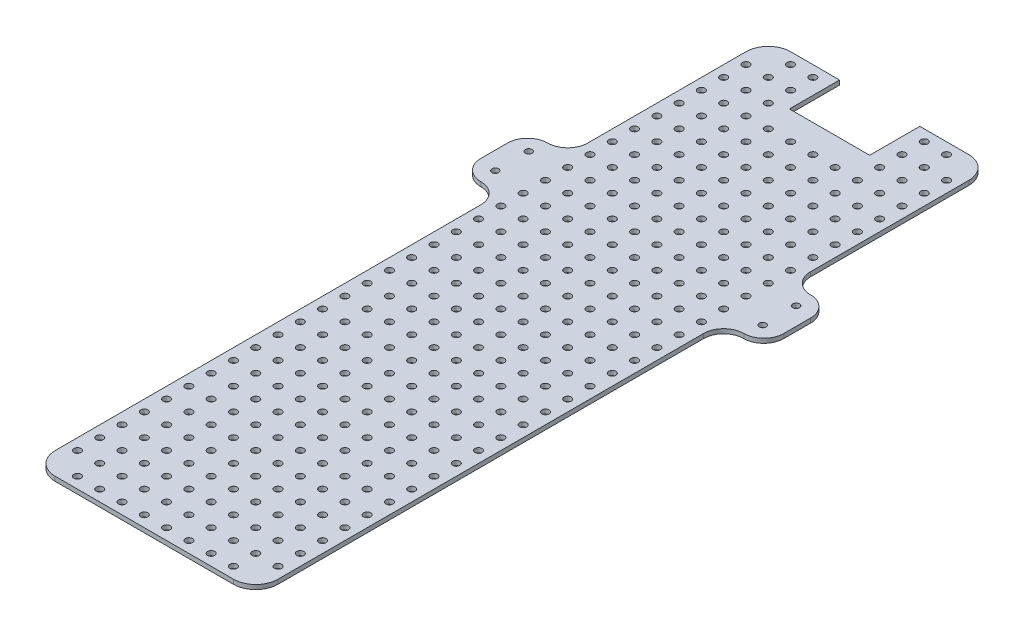
from build123d import *

# Parameters (mm, degrees)
SKETCH_1_W             = 100
SKETCH_1_H             = 330
EXTRUDE_593_DEPTH      = 2
SKETCH_3_W             = 18
SKETCH_3_H             = 30
EXTRUDE_1129_DEPTH     = 2
SKETCH_4_R             = 1.5
CUT_EXTRUDE_1192_DEPTH = 198.111643492
FILLET_4_R             = 10
FILLET_START           = -1
FILLET_6_DEPTH         = 4
FILLET_6_2_DEPTH       = 2
SKETCH_25_W            = 36
SKETCH_25_H            = 22.5
CUT_EXTRUDE_6939_DEPTH = 198.111643492
FILLET_8_R             = 10
SKETCH_31_R            = 1.6
CUT_EXTRUDE_10_DEPTH   = 2


with BuildPart() as part:
    # Эскиз1 → Extrude 593 (new body)
    with BuildSketch(Plane(origin=(0, 0, 0), x_dir=(1, 0, 0), z_dir=(0, 1, 0))):
        with Locations((0, -20)):
            Rectangle(SKETCH_1_W, SKETCH_1_H)
    extrude(amount=EXTRUDE_593_DEPTH)

    # Эскиз3 → Extrude 1129 (add)
    with BuildSketch(Plane(origin=(0, 2, 0), x_dir=(1, 0, 0), z_dir=(0, 1, 0))):
        with Locations((-59, 40)):
            Rectangle(SKETCH_3_W, SKETCH_3_H)
        with Locations((59, 40)):
            Rectangle(SKETCH_3_W, SKETCH_3_H)
    extrude(amount=-EXTRUDE_1129_DEPTH)

    # Эскиз4 → Cut-Extrude 1192 (cut, through all)
    with BuildSketch(Plane(origin=(0, 2, 0), x_dir=(1, 0, 0), z_dir=(0, 1, 0))):
        with Locations(Location((-60, 47.5, 0), (0, 0, 270))):
            Circle(SKETCH_4_R)
        with Locations(Location((-60, 32.5, 0), (0, 0, 270))):
            Circle(SKETCH_4_R)
        with Locations(Location((60, 47.5, 0), (0, 0, 270))):
            Circle(SKETCH_4_R)
        with Locations(Location((60, 32.5, 0), (0, 0, 270))):
            Circle(SKETCH_4_R)
    extrude(amount=-CUT_EXTRUDE_1192_DEPTH, mode=Mode.SUBTRACT)

    # Скругление4
    fillet_4_edges = [part.edges().sort_by_distance(p)[0] for p in [
        (50, 1, 185),
        (-50, 1, 185),
    ]]
    fillet(fillet_4_edges, radius=FILLET_4_R)

    # Скругление6: read off the stored shape, not the designer's step
    # Скругление6 outline → Скругление6 (cut)
    with BuildSketch(Plane(origin=(0, 0, 0), x_dir=(1, 0, 0), z_dir=(0, 1, 0)).offset(FILLET_START)):
        with BuildLine():
            Line((-68, 55), (-68, 46))
            ThreePointArc((-68, 46), (-65.363961031, 52.363961031), (-59, 55))
            Line((-59, 55), (-68, 55))
        make_face()
        with BuildLine():
            ThreePointArc((-59, 25), (-65.363961031, 27.636038969), (-68, 34))
            Line((-68, 34), (-68, 25))
            Line((-68, 25), (-59, 25))
        make_face()
        with BuildLine():
            ThreePointArc((59, 55), (65.363961031, 52.363961031), (68, 46))
            Line((68, 46), (68, 55))
            Line((68, 55), (59, 55))
        make_face()
        with BuildLine():
            ThreePointArc((68, 34), (65.363961031, 27.636038969), (59, 25))
            Line((59, 25), (68, 25))
            Line((68, 25), (68, 34))
        make_face()
    extrude(amount=FILLET_6_DEPTH, mode=Mode.SUBTRACT)

    # Fillet 6 2 outline → Fillet 6 2 (add)
    with BuildSketch(Plane(origin=(0, 0, 0), x_dir=(1, 0, 0), z_dir=(0, 1, 0))):
        with BuildLine():
            Line((-50, 25), (-59, 25))
            ThreePointArc((-59, 25), (-52.636038969, 22.363961031), (-50, 16))
            Line((-50, 16), (-50, 25))
        make_face()
        with BuildLine():
            ThreePointArc((-50, 64), (-52.636038969, 57.636038969), (-59, 55))
            Line((-59, 55), (-50, 55))
            Line((-50, 55), (-50, 64))
        make_face()
        with BuildLine():
            Line((50, 55), (59, 55))
            ThreePointArc((59, 55), (52.636038969, 57.636038969), (50, 64))
            Line((50, 64), (50, 55))
        make_face()
        with BuildLine():
            ThreePointArc((50, 16), (52.636038969, 22.363961031), (59, 25))
            Line((59, 25), (50, 25))
            Line((50, 25), (50, 16))
        make_face()
    extrude(amount=FILLET_6_2_DEPTH)

    # Эскиз25 → Cut-Extrude 6939 (cut, through all)
    with BuildSketch(Plane(origin=(0, 2, 0), x_dir=(1, 0, 0), z_dir=(0, 1, 0))):
        with Locations((0, 133.75)):
            Rectangle(SKETCH_25_W, SKETCH_25_H)
    extrude(amount=-CUT_EXTRUDE_6939_DEPTH, mode=Mode.SUBTRACT)

    # Скругление8
    fillet_8_edges = [part.edges().sort_by_distance(p)[0] for p in [
        (-50, 1, -145),
        (50, 1, -145),
    ]]
    fillet(fillet_8_edges, radius=FILLET_8_R)

    # Эскиз31 → Сетка 10мм (cut)
    with BuildSketch(Plane.XZ):
        with Locations(Location((-5, 180, 0), (0, 0, 270))):
            Circle(SKETCH_31_R)
        with Locations(Location((5, 180, 0), (0, 0, 270))):
            Circle(SKETCH_31_R)
        with Locations(Location((15, 180, 0), (0, 0, 270))):
            Circle(SKETCH_31_R)
        with Locations(Location((25, 180, 0), (0, 0, 270))):
            Circle(SKETCH_31_R)
        with Locations(Location((35, 180, 0), (0, 0, 270))):
            Circle(SKETCH_31_R)
        with Locations(Location((-15, 180, 0), (0, 0, 270))):
            Circle(SKETCH_31_R)
        with Locations(Location((-25, 180, 0), (0, 0, 270))):
            Circle(SKETCH_31_R)
        with Locations(Location((-35, 180, 0), (0, 0, 270))):
            Circle(SKETCH_31_R)
        with Locations(Location((-5, 170, 0), (0, 0, 270))):
            Circle(SKETCH_31_R)
        with Locations(Location((5, 170, 0), (0, 0, 270))):
            Circle(SKETCH_31_R)
        with Locations(Location((15, 170, 0), (0, 0, 270))):
            Circle(SKETCH_31_R)
        with Locations(Location((25, 170, 0), (0, 0, 270))):
            Circle(SKETCH_31_R)
        with Locations(Location((35, 170, 0), (0, 0, 270))):
            Circle(SKETCH_31_R)
        with Locations(Location((45, 170, 0), (0, 0, 270))):
            Circle(SKETCH_31_R)
        with Locations(Location((-15, 170, 0), (0, 0, 270))):
            Circle(SKETCH_31_R)
        with Locations(Location((-25, 170, 0), (0, 0, 270))):
            Circle(SKETCH_31_R)
        with Locations(Location((-35, 170, 0), (0, 0, 270))):
            Circle(SKETCH_31_R)
        with Locations(Location((-45, 170, 0), (0, 0, 270))):
            Circle(SKETCH_31_R)
        with Locations(Location((-5, 160, 0), (0, 0, 270))):
            Circle(SKETCH_31_R)
        with Locations(Location((5, 160, 0), (0, 0, 270))):
            Circle(SKETCH_31_R)
        with Locations(Location((15, 160, 0), (0, 0, 270))):
            Circle(SKETCH_31_R)
        with Locations(Location((25, 160, 0), (0, 0, 270))):
            Circle(SKETCH_31_R)
        with Locations(Location((35, 160, 0), (0, 0, 270))):
            Circle(SKETCH_31_R)
        with Locations(Location((45, 160, 0), (0, 0, 270))):
            Circle(SKETCH_31_R)
        with Locations(Location((-15, 160, 0), (0, 0, 270))):
            Circle(SKETCH_31_R)
        with Locations(Location((-25, 160, 0), (0, 0, 270))):
            Circle(SKETCH_31_R)
        with Locations(Location((-35, 160, 0), (0, 0, 270))):
            Circle(SKETCH_31_R)
        with Locations(Location((-45, 160, 0), (0, 0, 270))):
            Circle(SKETCH_31_R)
        with Locations(Location((-5, 150, 0), (0, 0, 270))):
            Circle(SKETCH_31_R)
        with Locations(Location((5, 150, 0), (0, 0, 270))):
            Circle(SKETCH_31_R)
        with Locations(Location((15, 150, 0), (0, 0, 270))):
            Circle(SKETCH_31_R)
        with Locations(Location((25, 150, 0), (0, 0, 270))):
            Circle(SKETCH_31_R)
        with Locations(Location((35, 150, 0), (0, 0, 270))):
            Circle(SKETCH_31_R)
        with Locations(Location((45, 150, 0), (0, 0, 270))):
            Circle(SKETCH_31_R)
        with Locations(Location((-15, 150, 0), (0, 0, 270))):
            Circle(SKETCH_31_R)
        with Locations(Location((-25, 150, 0), (0, 0, 270))):
            Circle(SKETCH_31_R)
        with Locations(Location((-35, 150, 0), (0, 0, 270))):
            Circle(SKETCH_31_R)
        with Locations(Location((-45, 150, 0), (0, 0, 270))):
            Circle(SKETCH_31_R)
        with Locations(Location((-5, 140, 0), (0, 0, 270))):
            Circle(SKETCH_31_R)
        with Locations(Location((5, 140, 0), (0, 0, 270))):
            Circle(SKETCH_31_R)
        with Locations(Location((15, 140, 0), (0, 0, 270))):
            Circle(SKETCH_31_R)
        with Locations(Location((25, 140, 0), (0, 0, 270))):
            Circle(SKETCH_31_R)
        with Locations(Location((35, 140, 0), (0, 0, 270))):
            Circle(SKETCH_31_R)
        with Locations(Location((45, 140, 0), (0, 0, 270))):
            Circle(SKETCH_31_R)
        with Locations(Location((-15, 140, 0), (0, 0, 270))):
            Circle(SKETCH_31_R)
        with Locations(Location((-25, 140, 0), (0, 0, 270))):
            Circle(SKETCH_31_R)
        with Locations(Location((-35, 140, 0), (0, 0, 270))):
            Circle(SKETCH_31_R)
        with Locations(Location((-45, 140, 0), (0, 0, 270))):
            Circle(SKETCH_31_R)
        with Locations(Location((-5, 130, 0), (0, 0, 270))):
            Circle(SKETCH_31_R)
        with Locations(Location((5, 130, 0), (0, 0, 270))):
            Circle(SKETCH_31_R)
        with Locations(Location((15, 130, 0), (0, 0, 270))):
            Circle(SKETCH_31_R)
        with Locations(Location((25, 130, 0), (0, 0, 270))):
            Circle(SKETCH_31_R)
        with Locations(Location((35, 130, 0), (0, 0, 270))):
            Circle(SKETCH_31_R)
        with Locations(Location((45, 130, 0), (0, 0, 270))):
            Circle(SKETCH_31_R)
        with Locations(Location((-15, 130, 0), (0, 0, 270))):
            Circle(SKETCH_31_R)
        with Locations(Location((-25, 130, 0), (0, 0, 270))):
            Circle(SKETCH_31_R)
        with Locations(Location((-35, 130, 0), (0, 0, 270))):
            Circle(SKETCH_31_R)
        with Locations(Location((-45, 130, 0), (0, 0, 270))):
            Circle(SKETCH_31_R)
        with Locations(Location((-5, 120, 0), (0, 0, 270))):
            Circle(SKETCH_31_R)
        with Locations(Location((5, 120, 0), (0, 0, 270))):
            Circle(SKETCH_31_R)
        with Locations(Location((15, 120, 0), (0, 0, 270))):
            Circle(SKETCH_31_R)
        with Locations(Location((25, 120, 0), (0, 0, 270))):
            Circle(SKETCH_31_R)
        with Locations(Location((35, 120, 0), (0, 0, 270))):
            Circle(SKETCH_31_R)
        with Locations(Location((45, 120, 0), (0, 0, 270))):
            Circle(SKETCH_31_R)
        with Locations(Location((-15, 120, 0), (0, 0, 270))):
            Circle(SKETCH_31_R)
        with Locations(Location((-25, 120, 0), (0, 0, 270))):
            Circle(SKETCH_31_R)
        with Locations(Location((-35, 120, 0), (0, 0, 270))):
            Circle(SKETCH_31_R)
        with Locations(Location((-45, 120, 0), (0, 0, 270))):
            Circle(SKETCH_31_R)
        with Locations(Location((-5, 110, 0), (0, 0, 270))):
            Circle(SKETCH_31_R)
        with Locations(Location((5, 110, 0), (0, 0, 270))):
            Circle(SKETCH_31_R)
        with Locations(Location((15, 110, 0), (0, 0, 270))):
            Circle(SKETCH_31_R)
        with Locations(Location((25, 110, 0), (0, 0, 270))):
            Circle(SKETCH_31_R)
        with Locations(Location((35, 110, 0), (0, 0, 270))):
            Circle(SKETCH_31_R)
        with Locations(Location((45, 110, 0), (0, 0, 270))):
            Circle(SKETCH_31_R)
        with Locations(Location((-15, 110, 0), (0, 0, 270))):
            Circle(SKETCH_31_R)
        with Locations(Location((-25, 110, 0), (0, 0, 270))):
            Circle(SKETCH_31_R)
        with Locations(Location((-35, 110, 0), (0, 0, 270))):
            Circle(SKETCH_31_R)
        with Locations(Location((-45, 110, 0), (0, 0, 270))):
            Circle(SKETCH_31_R)
        with Locations(Location((-5, 100, 0), (0, 0, 270))):
            Circle(SKETCH_31_R)
        with Locations(Location((5, 100, 0), (0, 0, 270))):
            Circle(SKETCH_31_R)
        with Locations(Location((15, 100, 0), (0, 0, 270))):
            Circle(SKETCH_31_R)
        with Locations(Location((25, 100, 0), (0, 0, 270))):
            Circle(SKETCH_31_R)
        with Locations(Location((35, 100, 0), (0, 0, 270))):
            Circle(SKETCH_31_R)
        with Locations(Location((45, 100, 0), (0, 0, 270))):
            Circle(SKETCH_31_R)
        with Locations(Location((-15, 100, 0), (0, 0, 270))):
            Circle(SKETCH_31_R)
        with Locations(Location((-25, 100, 0), (0, 0, 270))):
            Circle(SKETCH_31_R)
        with Locations(Location((-35, 100, 0), (0, 0, 270))):
            Circle(SKETCH_31_R)
        with Locations(Location((-45, 100, 0), (0, 0, 270))):
            Circle(SKETCH_31_R)
        with Locations(Location((-5, 90, 0), (0, 0, 270))):
            Circle(SKETCH_31_R)
        with Locations(Location((5, 90, 0), (0, 0, 270))):
            Circle(SKETCH_31_R)
        with Locations(Location((15, 90, 0), (0, 0, 270))):
            Circle(SKETCH_31_R)
        with Locations(Location((25, 90, 0), (0, 0, 270))):
            Circle(SKETCH_31_R)
        with Locations(Location((35, 90, 0), (0, 0, 270))):
            Circle(SKETCH_31_R)
        with Locations(Location((45, 90, 0), (0, 0, 270))):
            Circle(SKETCH_31_R)
        with Locations(Location((-15, 90, 0), (0, 0, 270))):
            Circle(SKETCH_31_R)
        with Locations(Location((-25, 90, 0), (0, 0, 270))):
            Circle(SKETCH_31_R)
        with Locations(Location((-35, 90, 0), (0, 0, 270))):
            Circle(SKETCH_31_R)
        with Locations(Location((-45, 90, 0), (0, 0, 270))):
            Circle(SKETCH_31_R)
        with Locations(Location((-5, 80, 0), (0, 0, 270))):
            Circle(SKETCH_31_R)
        with Locations(Location((5, 80, 0), (0, 0, 270))):
            Circle(SKETCH_31_R)
        with Locations(Location((15, 80, 0), (0, 0, 270))):
            Circle(SKETCH_31_R)
        with Locations(Location((25, 80, 0), (0, 0, 270))):
            Circle(SKETCH_31_R)
        with Locations(Location((35, 80, 0), (0, 0, 270))):
            Circle(SKETCH_31_R)
        with Locations(Location((45, 80, 0), (0, 0, 270))):
            Circle(SKETCH_31_R)
        with Locations(Location((-15, 80, 0), (0, 0, 270))):
            Circle(SKETCH_31_R)
        with Locations(Location((-25, 80, 0), (0, 0, 270))):
            Circle(SKETCH_31_R)
        with Locations(Location((-35, 80, 0), (0, 0, 270))):
            Circle(SKETCH_31_R)
        with Locations(Location((-45, 80, 0), (0, 0, 270))):
            Circle(SKETCH_31_R)
        with Locations(Location((-5, 70, 0), (0, 0, 270))):
            Circle(SKETCH_31_R)
        with Locations(Location((5, 70, 0), (0, 0, 270))):
            Circle(SKETCH_31_R)
        with Locations(Location((15, 70, 0), (0, 0, 270))):
            Circle(SKETCH_31_R)
        with Locations(Location((25, 70, 0), (0, 0, 270))):
            Circle(SKETCH_31_R)
        with Locations(Location((35, 70, 0), (0, 0, 270))):
            Circle(SKETCH_31_R)
        with Locations(Location((45, 70, 0), (0, 0, 270))):
            Circle(SKETCH_31_R)
        with Locations(Location((-15, 70, 0), (0, 0, 270))):
            Circle(SKETCH_31_R)
        with Locations(Location((-25, 70, 0), (0, 0, 270))):
            Circle(SKETCH_31_R)
        with Locations(Location((-35, 70, 0), (0, 0, 270))):
            Circle(SKETCH_31_R)
        with Locations(Location((-45, 70, 0), (0, 0, 270))):
            Circle(SKETCH_31_R)
        with Locations(Location((-5, 60, 0), (0, 0, 270))):
            Circle(SKETCH_31_R)
        with Locations(Location((5, 60, 0), (0, 0, 270))):
            Circle(SKETCH_31_R)
        with Locations(Location((15, 60, 0), (0, 0, 270))):
            Circle(SKETCH_31_R)
        with Locations(Location((25, 60, 0), (0, 0, 270))):
            Circle(SKETCH_31_R)
        with Locations(Location((35, 60, 0), (0, 0, 270))):
            Circle(SKETCH_31_R)
        with Locations(Location((45, 60, 0), (0, 0, 270))):
            Circle(SKETCH_31_R)
        with Locations(Location((-15, 60, 0), (0, 0, 270))):
            Circle(SKETCH_31_R)
        with Locations(Location((-25, 60, 0), (0, 0, 270))):
            Circle(SKETCH_31_R)
        with Locations(Location((-35, 60, 0), (0, 0, 270))):
            Circle(SKETCH_31_R)
        with Locations(Location((-45, 60, 0), (0, 0, 270))):
            Circle(SKETCH_31_R)
        with Locations(Location((-5, 50, 0), (0, 0, 270))):
            Circle(SKETCH_31_R)
        with Locations(Location((5, 50, 0), (0, 0, 270))):
            Circle(SKETCH_31_R)
        with Locations(Location((15, 50, 0), (0, 0, 270))):
            Circle(SKETCH_31_R)
        with Locations(Location((25, 50, 0), (0, 0, 270))):
            Circle(SKETCH_31_R)
        with Locations(Location((35, 50, 0), (0, 0, 270))):
            Circle(SKETCH_31_R)
        with Locations(Location((45, 50, 0), (0, 0, 270))):
            Circle(SKETCH_31_R)
        with Locations(Location((-15, 50, 0), (0, 0, 270))):
            Circle(SKETCH_31_R)
        with Locations(Location((-25, 50, 0), (0, 0, 270))):
            Circle(SKETCH_31_R)
        with Locations(Location((-35, 50, 0), (0, 0, 270))):
            Circle(SKETCH_31_R)
        with Locations(Location((-45, 50, 0), (0, 0, 270))):
            Circle(SKETCH_31_R)
        with Locations(Location((-5, 40, 0), (0, 0, 270))):
            Circle(SKETCH_31_R)
        with Locations(Location((5, 40, 0), (0, 0, 270))):
            Circle(SKETCH_31_R)
        with Locations(Location((15, 40, 0), (0, 0, 270))):
            Circle(SKETCH_31_R)
        with Locations(Location((25, 40, 0), (0, 0, 270))):
            Circle(SKETCH_31_R)
        with Locations(Location((35, 40, 0), (0, 0, 270))):
            Circle(SKETCH_31_R)
        with Locations(Location((45, 40, 0), (0, 0, 270))):
            Circle(SKETCH_31_R)
        with Locations(Location((-15, 40, 0), (0, 0, 270))):
            Circle(SKETCH_31_R)
        with Locations(Location((-25, 40, 0), (0, 0, 270))):
            Circle(SKETCH_31_R)
        with Locations(Location((-35, 40, 0), (0, 0, 270))):
            Circle(SKETCH_31_R)
        with Locations(Location((-45, 40, 0), (0, 0, 270))):
            Circle(SKETCH_31_R)
        with Locations(Location((-5, 30, 0), (0, 0, 270))):
            Circle(SKETCH_31_R)
        with Locations(Location((5, 30, 0), (0, 0, 270))):
            Circle(SKETCH_31_R)
        with Locations(Location((15, 30, 0), (0, 0, 270))):
            Circle(SKETCH_31_R)
        with Locations(Location((25, 30, 0), (0, 0, 270))):
            Circle(SKETCH_31_R)
        with Locations(Location((35, 30, 0), (0, 0, 270))):
            Circle(SKETCH_31_R)
        with Locations(Location((45, 30, 0), (0, 0, 270))):
            Circle(SKETCH_31_R)
        with Locations(Location((-15, 30, 0), (0, 0, 270))):
            Circle(SKETCH_31_R)
        with Locations(Location((-25, 30, 0), (0, 0, 270))):
            Circle(SKETCH_31_R)
        with Locations(Location((-35, 30, 0), (0, 0, 270))):
            Circle(SKETCH_31_R)
        with Locations(Location((-45, 30, 0), (0, 0, 270))):
            Circle(SKETCH_31_R)
        with Locations(Location((-5, 20, 0), (0, 0, 270))):
            Circle(SKETCH_31_R)
        with Locations(Location((5, 20, 0), (0, 0, 270))):
            Circle(SKETCH_31_R)
        with Locations(Location((15, 20, 0), (0, 0, 270))):
            Circle(SKETCH_31_R)
        with Locations(Location((25, 20, 0), (0, 0, 270))):
            Circle(SKETCH_31_R)
        with Locations(Location((35, 20, 0), (0, 0, 270))):
            Circle(SKETCH_31_R)
        with Locations(Location((45, 20, 0), (0, 0, 270))):
            Circle(SKETCH_31_R)
        with Locations(Location((-15, 20, 0), (0, 0, 270))):
            Circle(SKETCH_31_R)
        with Locations(Location((-25, 20, 0), (0, 0, 270))):
            Circle(SKETCH_31_R)
        with Locations(Location((-35, 20, 0), (0, 0, 270))):
            Circle(SKETCH_31_R)
        with Locations(Location((-45, 20, 0), (0, 0, 270))):
            Circle(SKETCH_31_R)
        with Locations(Location((-5, 10, 0), (0, 0, 270))):
            Circle(SKETCH_31_R)
        with Locations(Location((5, 10, 0), (0, 0, 270))):
            Circle(SKETCH_31_R)
        with Locations(Location((15, 10, 0), (0, 0, 270))):
            Circle(SKETCH_31_R)
        with Locations(Location((25, 10, 0), (0, 0, 270))):
            Circle(SKETCH_31_R)
        with Locations(Location((35, 10, 0), (0, 0, 270))):
            Circle(SKETCH_31_R)
        with Locations(Location((45, 10, 0), (0, 0, 270))):
            Circle(SKETCH_31_R)
        with Locations(Location((-15, 10, 0), (0, 0, 270))):
            Circle(SKETCH_31_R)
        with Locations(Location((-25, 10, 0), (0, 0, 270))):
            Circle(SKETCH_31_R)
        with Locations(Location((-35, 10, 0), (0, 0, 270))):
            Circle(SKETCH_31_R)
        with Locations(Location((-45, 10, 0), (0, 0, 270))):
            Circle(SKETCH_31_R)
        with Locations(Location((-5, 0, 0), (0, 0, 270))):
            Circle(SKETCH_31_R)
        with Locations(Location((5, 0, 0), (0, 0, 270))):
            Circle(SKETCH_31_R)
        with Locations(Location((15, 0, 0), (0, 0, 270))):
            Circle(SKETCH_31_R)
        with Locations(Location((25, 0, 0), (0, 0, 270))):
            Circle(SKETCH_31_R)
        with Locations(Location((35, 0, 0), (0, 0, 270))):
            Circle(SKETCH_31_R)
        with Locations(Location((45, 0, 0), (0, 0, 270))):
            Circle(SKETCH_31_R)
        with Locations(Location((-15, 0, 0), (0, 0, 270))):
            Circle(SKETCH_31_R)
        with Locations(Location((-25, 0, 0), (0, 0, 270))):
            Circle(SKETCH_31_R)
        with Locations(Location((-35, 0, 0), (0, 0, 270))):
            Circle(SKETCH_31_R)
        with Locations(Location((-45, 0, 0), (0, 0, 270))):
            Circle(SKETCH_31_R)
        with Locations(Location((-5, -10, 0), (0, 0, 270))):
            Circle(SKETCH_31_R)
        with Locations(Location((5, -10, 0), (0, 0, 270))):
            Circle(SKETCH_31_R)
        with Locations(Location((15, -10, 0), (0, 0, 270))):
            Circle(SKETCH_31_R)
        with Locations(Location((25, -10, 0), (0, 0, 270))):
            Circle(SKETCH_31_R)
        with Locations(Location((35, -10, 0), (0, 0, 270))):
            Circle(SKETCH_31_R)
        with Locations(Location((45, -10, 0), (0, 0, 270))):
            Circle(SKETCH_31_R)
        with Locations(Location((-15, -10, 0), (0, 0, 270))):
            Circle(SKETCH_31_R)
        with Locations(Location((-25, -10, 0), (0, 0, 270))):
            Circle(SKETCH_31_R)
        with Locations(Location((-35, -10, 0), (0, 0, 270))):
            Circle(SKETCH_31_R)
        with Locations(Location((-45, -10, 0), (0, 0, 270))):
            Circle(SKETCH_31_R)
        with Locations(Location((-5, -20, 0), (0, 0, 270))):
            Circle(SKETCH_31_R)
        with Locations(Location((5, -20, 0), (0, 0, 270))):
            Circle(SKETCH_31_R)
        with Locations(Location((15, -20, 0), (0, 0, 270))):
            Circle(SKETCH_31_R)
        with Locations(Location((25, -20, 0), (0, 0, 270))):
            Circle(SKETCH_31_R)
        with Locations(Location((35, -20, 0), (0, 0, 270))):
            Circle(SKETCH_31_R)
        with Locations(Location((45, -20, 0), (0, 0, 270))):
            Circle(SKETCH_31_R)
        with Locations(Location((-15, -20, 0), (0, 0, 270))):
            Circle(SKETCH_31_R)
        with Locations(Location((-25, -20, 0), (0, 0, 270))):
            Circle(SKETCH_31_R)
        with Locations(Location((-35, -20, 0), (0, 0, 270))):
            Circle(SKETCH_31_R)
        with Locations(Location((-45, -20, 0), (0, 0, 270))):
            Circle(SKETCH_31_R)
        with Locations(Location((-5, -30, 0), (0, 0, 270))):
            Circle(SKETCH_31_R)
        with Locations(Location((5, -30, 0), (0, 0, 270))):
            Circle(SKETCH_31_R)
        with Locations(Location((15, -30, 0), (0, 0, 270))):
            Circle(SKETCH_31_R)
        with Locations(Location((25, -30, 0), (0, 0, 270))):
            Circle(SKETCH_31_R)
        with Locations(Location((35, -30, 0), (0, 0, 270))):
            Circle(SKETCH_31_R)
        with Locations(Location((45, -30, 0), (0, 0, 270))):
            Circle(SKETCH_31_R)
        with Locations(Location((-15, -30, 0), (0, 0, 270))):
            Circle(SKETCH_31_R)
        with Locations(Location((-25, -30, 0), (0, 0, 270))):
            Circle(SKETCH_31_R)
        with Locations(Location((-35, -30, 0), (0, 0, 270))):
            Circle(SKETCH_31_R)
        with Locations(Location((-45, -30, 0), (0, 0, 270))):
            Circle(SKETCH_31_R)
        with Locations(Location((-5, -40, 0), (0, 0, 270))):
            Circle(SKETCH_31_R)
        with Locations(Location((5, -40, 0), (0, 0, 270))):
            Circle(SKETCH_31_R)
        with Locations(Location((15, -40, 0), (0, 0, 270))):
            Circle(SKETCH_31_R)
        with Locations(Location((25, -40, 0), (0, 0, 270))):
            Circle(SKETCH_31_R)
        with Locations(Location((35, -40, 0), (0, 0, 270))):
            Circle(SKETCH_31_R)
        with Locations(Location((45, -40, 0), (0, 0, 270))):
            Circle(SKETCH_31_R)
        with Locations(Location((-15, -40, 0), (0, 0, 270))):
            Circle(SKETCH_31_R)
        with Locations(Location((-25, -40, 0), (0, 0, 270))):
            Circle(SKETCH_31_R)
        with Locations(Location((-35, -40, 0), (0, 0, 270))):
            Circle(SKETCH_31_R)
        with Locations(Location((-45, -40, 0), (0, 0, 270))):
            Circle(SKETCH_31_R)
        with Locations(Location((-5, -50, 0), (0, 0, 270))):
            Circle(SKETCH_31_R)
        with Locations(Location((5, -50, 0), (0, 0, 270))):
            Circle(SKETCH_31_R)
        with Locations(Location((15, -50, 0), (0, 0, 270))):
            Circle(SKETCH_31_R)
        with Locations(Location((25, -50, 0), (0, 0, 270))):
            Circle(SKETCH_31_R)
        with Locations(Location((35, -50, 0), (0, 0, 270))):
            Circle(SKETCH_31_R)
        with Locations(Location((45, -50, 0), (0, 0, 270))):
            Circle(SKETCH_31_R)
        with Locations(Location((-15, -50, 0), (0, 0, 270))):
            Circle(SKETCH_31_R)
        with Locations(Location((-25, -50, 0), (0, 0, 270))):
            Circle(SKETCH_31_R)
        with Locations(Location((-35, -50, 0), (0, 0, 270))):
            Circle(SKETCH_31_R)
        with Locations(Location((-45, -50, 0), (0, 0, 270))):
            Circle(SKETCH_31_R)
        with Locations(Location((-5, -60, 0), (0, 0, 270))):
            Circle(SKETCH_31_R)
        with Locations(Location((5, -60, 0), (0, 0, 270))):
            Circle(SKETCH_31_R)
        with Locations(Location((15, -60, 0), (0, 0, 270))):
            Circle(SKETCH_31_R)
        with Locations(Location((25, -60, 0), (0, 0, 270))):
            Circle(SKETCH_31_R)
        with Locations(Location((35, -60, 0), (0, 0, 270))):
            Circle(SKETCH_31_R)
        with Locations(Location((45, -60, 0), (0, 0, 270))):
            Circle(SKETCH_31_R)
        with Locations(Location((-15, -60, 0), (0, 0, 270))):
            Circle(SKETCH_31_R)
        with Locations(Location((-25, -60, 0), (0, 0, 270))):
            Circle(SKETCH_31_R)
        with Locations(Location((-35, -60, 0), (0, 0, 270))):
            Circle(SKETCH_31_R)
        with Locations(Location((-45, -60, 0), (0, 0, 270))):
            Circle(SKETCH_31_R)
        with Locations(Location((-5, -70, 0), (0, 0, 270))):
            Circle(SKETCH_31_R)
        with Locations(Location((5, -70, 0), (0, 0, 270))):
            Circle(SKETCH_31_R)
        with Locations(Location((15, -70, 0), (0, 0, 270))):
            Circle(SKETCH_31_R)
        with Locations(Location((25, -70, 0), (0, 0, 270))):
            Circle(SKETCH_31_R)
        with Locations(Location((35, -70, 0), (0, 0, 270))):
            Circle(SKETCH_31_R)
        with Locations(Location((45, -70, 0), (0, 0, 270))):
            Circle(SKETCH_31_R)
        with Locations(Location((-15, -70, 0), (0, 0, 270))):
            Circle(SKETCH_31_R)
        with Locations(Location((-25, -70, 0), (0, 0, 270))):
            Circle(SKETCH_31_R)
        with Locations(Location((-35, -70, 0), (0, 0, 270))):
            Circle(SKETCH_31_R)
        with Locations(Location((-45, -70, 0), (0, 0, 270))):
            Circle(SKETCH_31_R)
        with Locations(Location((-5, -80, 0), (0, 0, 270))):
            Circle(SKETCH_31_R)
        with Locations(Location((5, -80, 0), (0, 0, 270))):
            Circle(SKETCH_31_R)
        with Locations(Location((15, -80, 0), (0, 0, 270))):
            Circle(SKETCH_31_R)
        with Locations(Location((25, -80, 0), (0, 0, 270))):
            Circle(SKETCH_31_R)
        with Locations(Location((35, -80, 0), (0, 0, 270))):
            Circle(SKETCH_31_R)
        with Locations(Location((45, -80, 0), (0, 0, 270))):
            Circle(SKETCH_31_R)
        with Locations(Location((-15, -80, 0), (0, 0, 270))):
            Circle(SKETCH_31_R)
        with Locations(Location((-25, -80, 0), (0, 0, 270))):
            Circle(SKETCH_31_R)
        with Locations(Location((-35, -80, 0), (0, 0, 270))):
            Circle(SKETCH_31_R)
        with Locations(Location((-45, -80, 0), (0, 0, 270))):
            Circle(SKETCH_31_R)
        with Locations(Location((-5, -90, 0), (0, 0, 270))):
            Circle(SKETCH_31_R)
        with Locations(Location((5, -90, 0), (0, 0, 270))):
            Circle(SKETCH_31_R)
        with Locations(Location((15, -90, 0), (0, 0, 270))):
            Circle(SKETCH_31_R)
        with Locations(Location((25, -90, 0), (0, 0, 270))):
            Circle(SKETCH_31_R)
        with Locations(Location((35, -90, 0), (0, 0, 270))):
            Circle(SKETCH_31_R)
        with Locations(Location((45, -90, 0), (0, 0, 270))):
            Circle(SKETCH_31_R)
        with Locations(Location((-15, -90, 0), (0, 0, 270))):
            Circle(SKETCH_31_R)
        with Locations(Location((-25, -90, 0), (0, 0, 270))):
            Circle(SKETCH_31_R)
        with Locations(Location((-35, -90, 0), (0, 0, 270))):
            Circle(SKETCH_31_R)
        with Locations(Location((-45, -90, 0), (0, 0, 270))):
            Circle(SKETCH_31_R)
        with Locations(Location((-5, -100, 0), (0, 0, 270))):
            Circle(SKETCH_31_R)
        with Locations(Location((5, -100, 0), (0, 0, 270))):
            Circle(SKETCH_31_R)
        with Locations(Location((15, -100, 0), (0, 0, 270))):
            Circle(SKETCH_31_R)
        with Locations(Location((25, -100, 0), (0, 0, 270))):
            Circle(SKETCH_31_R)
        with Locations(Location((35, -100, 0), (0, 0, 270))):
            Circle(SKETCH_31_R)
        with Locations(Location((45, -100, 0), (0, 0, 270))):
            Circle(SKETCH_31_R)
        with Locations(Location((-15, -100, 0), (0, 0, 270))):
            Circle(SKETCH_31_R)
        with Locations(Location((-25, -100, 0), (0, 0, 270))):
            Circle(SKETCH_31_R)
        with Locations(Location((-35, -100, 0), (0, 0, 270))):
            Circle(SKETCH_31_R)
        with Locations(Location((-45, -100, 0), (0, 0, 270))):
            Circle(SKETCH_31_R)
        with Locations(Location((-35, -110, 0), (0, 0, 270))):
            Circle(SKETCH_31_R)
        with Locations(Location((-45, -110, 0), (0, 0, 270))):
            Circle(SKETCH_31_R)
        with Locations(Location((-35, -120, 0), (0, 0, 270))):
            Circle(SKETCH_31_R)
        with Locations(Location((-45, -120, 0), (0, 0, 270))):
            Circle(SKETCH_31_R)
        with Locations(Location((-35, -130, 0), (0, 0, 270))):
            Circle(SKETCH_31_R)
        with Locations(Location((-45, -130, 0), (0, 0, 270))):
            Circle(SKETCH_31_R)
        with Locations(Location((35, -110, 0), (0, 0, 270))):
            Circle(SKETCH_31_R)
        with Locations(Location((45, -110, 0), (0, 0, 270))):
            Circle(SKETCH_31_R)
        with Locations(Location((35, -120, 0), (0, 0, 270))):
            Circle(SKETCH_31_R)
        with Locations(Location((45, -120, 0), (0, 0, 270))):
            Circle(SKETCH_31_R)
        with Locations(Location((35, -130, 0), (0, 0, 270))):
            Circle(SKETCH_31_R)
        with Locations(Location((45, -130, 0), (0, 0, 270))):
            Circle(SKETCH_31_R)
        with Locations(Location((-5, -110, 0), (0, 0, 270))):
            Circle(SKETCH_31_R)
        with Locations(Location((5, -110, 0), (0, 0, 270))):
            Circle(SKETCH_31_R)
        with Locations(Location((15, -110, 0), (0, 0, 270))):
            Circle(SKETCH_31_R)
        with Locations(Location((25, -110, 0), (0, 0, 270))):
            Circle(SKETCH_31_R)
        with Locations(Location((-15, -110, 0), (0, 0, 270))):
            Circle(SKETCH_31_R)
        with Locations(Location((-25, -110, 0), (0, 0, 270))):
            Circle(SKETCH_31_R)
        with Locations(Location((-35, -140, 0), (0, 0, 270))):
            Circle(SKETCH_31_R)
        with Locations(Location((35, -140, 0), (0, 0, 270))):
            Circle(SKETCH_31_R)
        with Locations(Location((-25, -120, 0), (0, 0, 270))):
            Circle(SKETCH_31_R)
        with Locations(Location((25, -120, 0), (0, 0, 270))):
            Circle(SKETCH_31_R)
        with Locations(Location((-25, -130, 0), (0, 0, 270))):
            Circle(SKETCH_31_R)
        with Locations(Location((25, -130, 0), (0, 0, 270))):
            Circle(SKETCH_31_R)
        with Locations(Location((-25, -140, 0), (0, 0, 270))):
            Circle(SKETCH_31_R)
        with Locations(Location((25, -140, 0), (0, 0, 270))):
            Circle(SKETCH_31_R)
    extrude(amount=-CUT_EXTRUDE_10_DEPTH, mode=Mode.SUBTRACT)


solid = part.part
